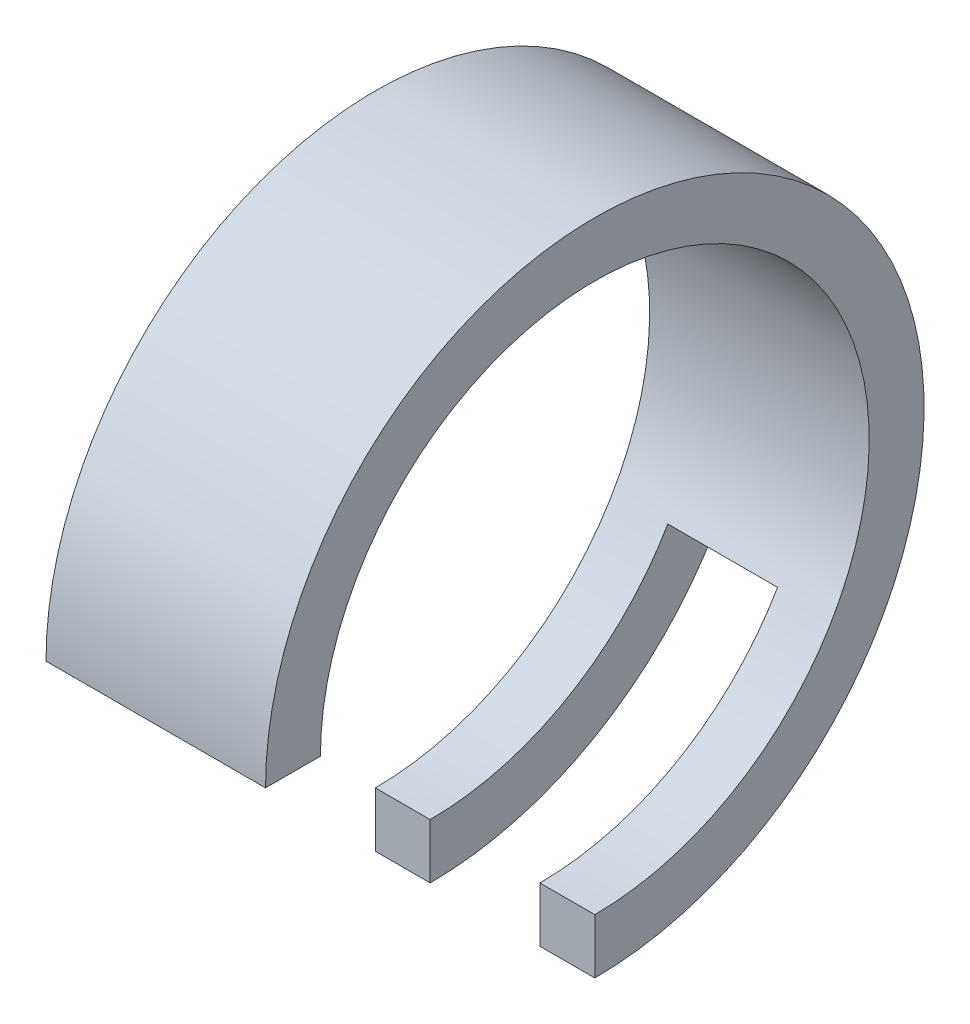
from build123d import *

# Parameters (mm, degrees)
SKETCH1_W          = 5
SKETCH1_H          = 5
SKETCH1_W_2        = 10
REVOLVE1_ANGLE     = 270
CUT_REVOLVE1_START = 5
CUT_REVOLVE1_DEPTH = 10


# Read off the part's stored shape, not the designer's step: Cut-Revolve1
with BuildPart() as part:
    # Sketch1 → Revolve1 (revolve)
    with BuildSketch(Plane.XY):
        with Locations((2.5, -2.5)):
            Rectangle(SKETCH1_W, SKETCH1_H)
        with Locations((17.5, -2.5)):
            Rectangle(SKETCH1_W, SKETCH1_H)
        with Locations((10, -2.5)):
            Rectangle(SKETCH1_W_2, SKETCH1_H)
    revolve(axis=Axis((-365.597578267, 25, 0), (1, 0, 0)), revolution_arc=REVOLVE1_ANGLE)

    # Cut-Revolve1 outline → Cut-Revolve1 (cut)
    with BuildSketch(Plane.YZ.offset(CUT_REVOLVE1_START)):
        with BuildLine():
            Line((10, -25.980762114), (12.5, -21.650635095))
            ThreePointArc((12.5, -21.650635095), (3.349364905, -12.5), (0, 0))
            Line((0, 0), (-5, 0))
            ThreePointArc((-5, 0), (-0.980762114, -15), (10, -25.980762114))
        make_face()
    extrude(amount=CUT_REVOLVE1_DEPTH, mode=Mode.SUBTRACT)


solid = part.part
